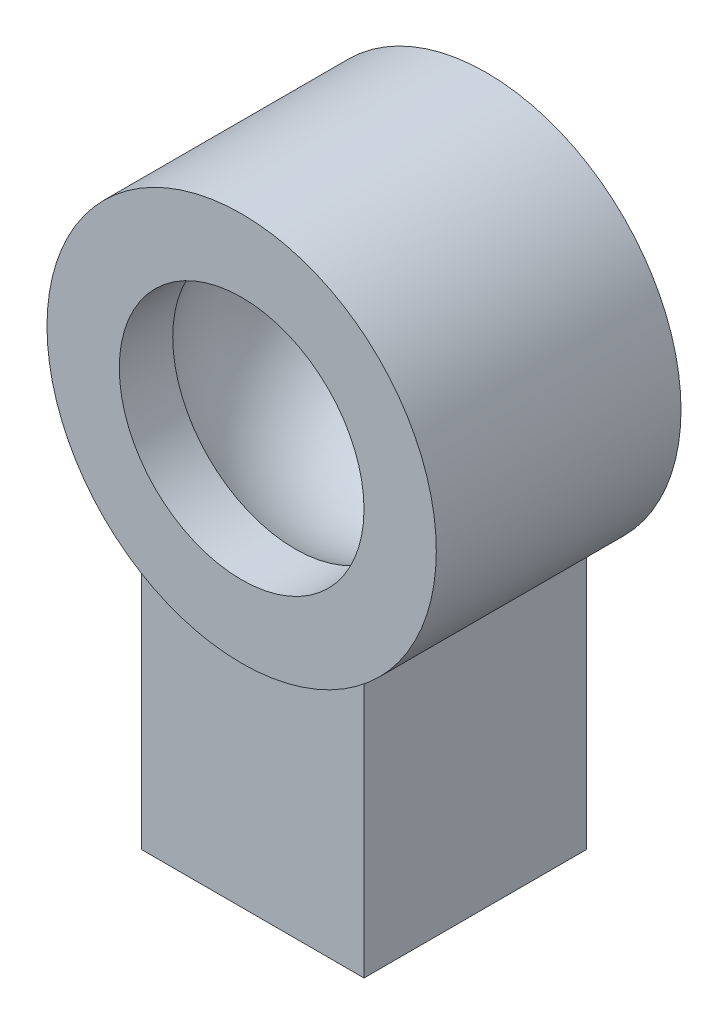
from build123d import *

# Parameters (mm, degrees)
SOCKET_OUTER_EYE_AND_MOUTHS_START = -2.2
SKETCH1_R                         = 3.5
SKETCH1_R_2                       = 2.2
SOCKET_OUTER_EYE_AND_MOUTHS_DEPTH = 4.4
ROD_CONNECTION_NECK_START         = -2
SKETCH2_W                         = 4
SKETCH2_H                         = 5.3
ROD_CONNECTION_NECK_DEPTH         = 4
SKETCH3_R                         = 1.05
D2P1_ROD_BOND_BORE_DEPTH          = 2.7


# Read off the part's stored shape, not the designer's step: Spherical_Socket_D5p05
with BuildPart() as part:
    # Sketch1 → Socket_Outer_Eye_And_Mouths (new body)
    with BuildSketch(Plane.XY.offset(SOCKET_OUTER_EYE_AND_MOUTHS_START)):
        Circle(SKETCH1_R)
        Circle(SKETCH1_R_2, mode=Mode.SUBTRACT)
    extrude(amount=SOCKET_OUTER_EYE_AND_MOUTHS_DEPTH)

    # Sketch2 → Rod_Connection_Neck (add)
    with BuildSketch(Plane.XY.offset(ROD_CONNECTION_NECK_START)):
        with Locations((0, -4.85)):
            Rectangle(SKETCH2_W, SKETCH2_H)
    extrude(amount=ROD_CONNECTION_NECK_DEPTH)

    # Spherical_Socket_D5p05 outline → Spherical_Socket_D5p05 (revolve, cut)
    with BuildSketch(Plane.XZ):
        with BuildLine():
            Line((2.199999999, 1.239203375), (2.199999999, -1.239203375))
            ThreePointArc((2.199999999, -1.239203375), (2.525, 0), (2.199999999, 1.239203375))
        make_face()
    revolve(axis=Axis((0, 0, 0), (0, 0, 1)), mode=Mode.SUBTRACT)

    # Sketch3 → D2p1_Rod_Bond_Bore (cut)
    with BuildSketch(Plane.XZ.offset(7.5)):
        with Locations(Location((0, 0, 0), (0, 0, 270))):
            Circle(SKETCH3_R)
    extrude(amount=-D2P1_ROD_BOND_BORE_DEPTH, mode=Mode.SUBTRACT)


solid = part.part
